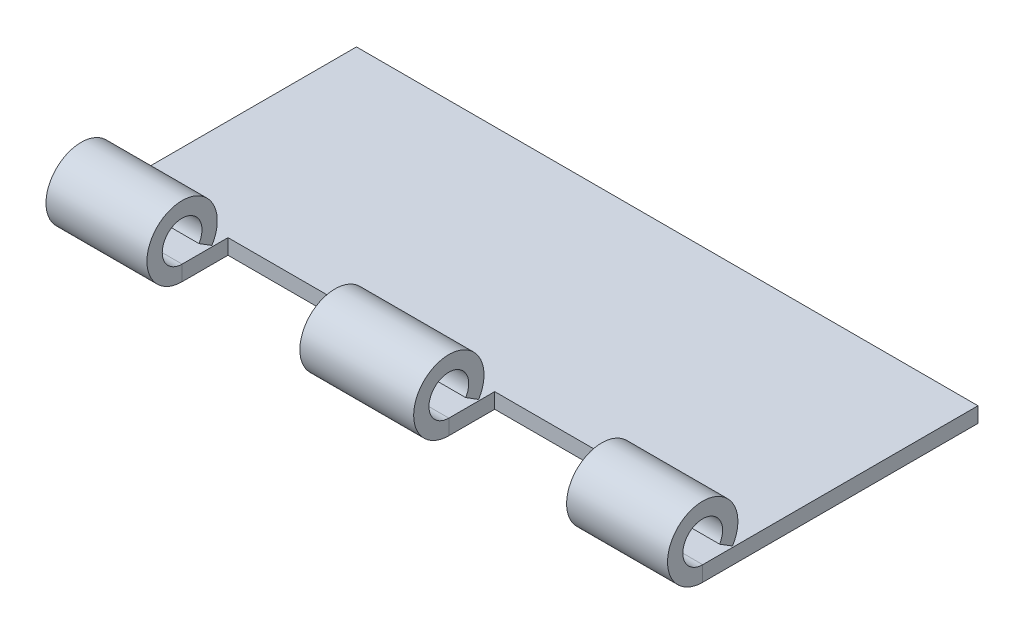
from build123d import *

# Parameters (mm, degrees)
BASE_FLANGE1_DEPTH      = 50.8
CUT_EXTRUDE1_DEPTH      = 69.10802082
CUT_EXTRUDE1_DEPTH_BACK = 69.10802082
SKETCH6_W               = 25
SKETCH6_H               = 58.775055245


# Sheet-metal steps are written as plain solids
with BuildPart() as part:
    # Sketch1 → Base-Flange1 (new, symmetric)
    with BuildSketch(Plane(origin=(0, 0, 0), x_dir=(0, 0, -1), z_dir=(1, 0, 0))):
        with BuildLine():
            Line((45, -5.75), (0, -5.75))
            ThreePointArc((0, -5.75), (-2.786126343, 5.029910536), (4.874423043, -3.05))
            Line((4.874423043, -3.05), (2.755108676, -1.723913043))
            ThreePointArc((2.755108676, -1.723913043), (-1.574767064, 2.842992912), (0, -3.25))
            Line((0, -3.25), (45, -3.25))
            Line((45, -3.25), (45, -5.75))
        make_face()
    extrude(amount=BASE_FLANGE1_DEPTH, both=True)

    # Sketch6 → Cut-Extrude1 (cut, two sides: drawn at the far end of the back side and taken through both)
    with BuildSketch(Plane(origin=(0, 0, 0), x_dir=(1, 0, 0), z_dir=(0, 1, 0)).offset(-CUT_EXTRUDE1_DEPTH_BACK)):
        with Locations((-21.8, -21.887527623)):
            Rectangle(SKETCH6_W, SKETCH6_H)
        with Locations((21.8, -21.887527623)):
            Rectangle(SKETCH6_W, SKETCH6_H)
    extrude(amount=CUT_EXTRUDE1_DEPTH + CUT_EXTRUDE1_DEPTH_BACK, mode=Mode.SUBTRACT)


solid = part.part
